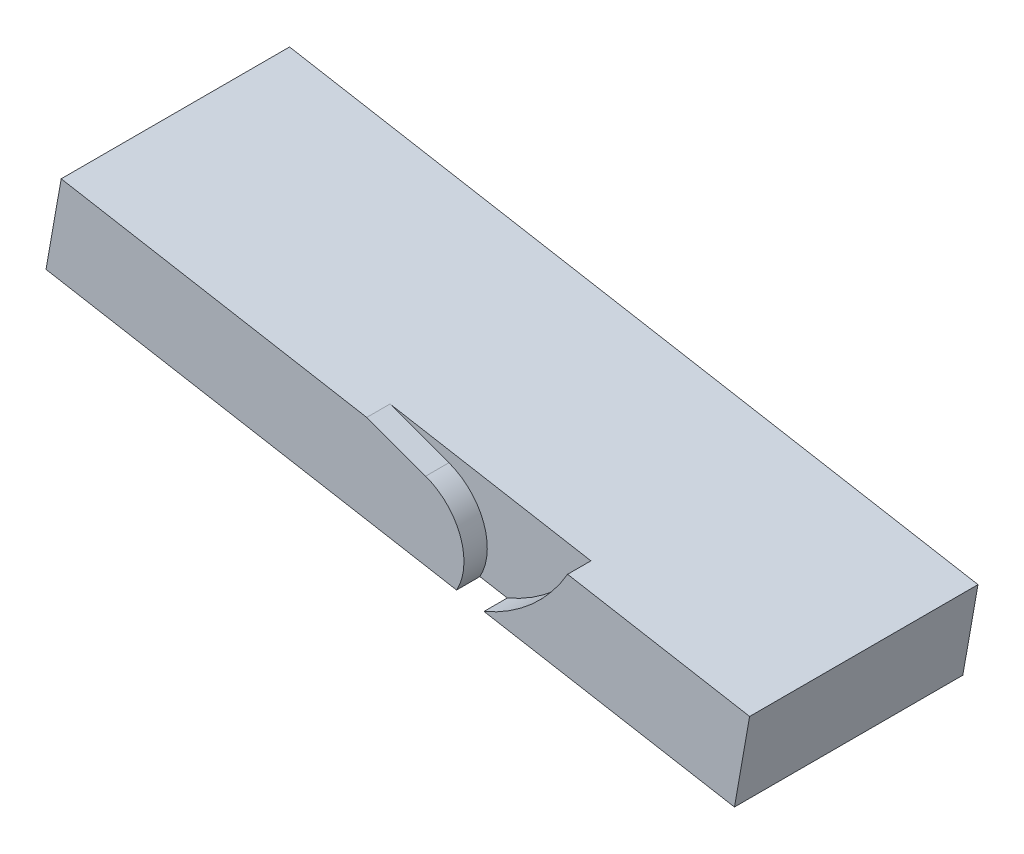
from build123d import *

# Parameters (mm, degrees)
BOSS_EXTRUDE1_DEPTH        = 3.048
BOSS_EXTRUDE2_DEPTH        = 2.032
BOSS_EXTRUDE2_DEPTH_BACK   = 47.752
BOSS_EXTRUDE2_2_DEPTH      = 2.032
BOSS_EXTRUDE2_2_DEPTH_BACK = 47.752


with BuildPart() as part:
    # Sketch1 → Boss-Extrude1 (new, symmetric)
    with BuildSketch(Plane.XY):
        with BuildLine():
            ThreePointArc((0, 27.535484012), (-9.412998127, 39.802742006), (0, 52.07))
            Line((0, 52.07), (-11.040532194, 49.111698314))
            ThreePointArc((-11.040532194, 49.111698314), (-39.066320922, 14.192289272), (-14.190605813, -23.03684931))
            Line((-14.190605813, -23.03684931), (0, -28.201807432))
            ThreePointArc((0, -28.201807432), (8.35634418, -40.135903716), (0, -52.07))
            Line((0, -52.07), (10.740686656, -48.160709762))
            ThreePointArc((10.740686656, -48.160709762), (36.144496882, -10.141220984), (7.52373904, 25.519504212))
            Line((7.52373904, 25.519504212), (0, 27.535484012))
        make_face()
        with BuildLine():
            Line((-12.7, 7.332348419), (-1.374815329, 13.870946837))
            ThreePointArc((-1.374815329, 13.870946837), (-0.410875234, 16.198104087), (1.5875, 14.664696837))
            ThreePointArc((1.5875, 14.664696837), (1.533407249, 14.253821603), (1.374815329, 13.870946837))
            Line((1.374815329, 13.870946837), (12.7, 7.332348419))
            Line((12.7, 7.332348419), (12.7, -7.332348419))
            Line((12.7, -7.332348419), (0, -14.664696837))
            Line((0, -14.664696837), (-12.7, -7.332348419))
            Line((-12.7, -7.332348419), (-12.7, 7.332348419))
        make_face(mode=Mode.SUBTRACT)
    extrude(amount=BOSS_EXTRUDE1_DEPTH, both=True)


with BuildPart() as body_2:
    # Sketch2 → Boss-Extrude2 (new, two sides: drawn at the far end of the back side and taken through both)
    with BuildSketch(Plane.XY.offset(-BOSS_EXTRUDE2_DEPTH_BACK)):
        Polygon((-70.631687067, 38.246108065), (79.453014492, 11.782125788), (82.761012277, 30.542713483), (-67.323689282, 57.00669576), align=None)
    extrude(amount=BOSS_EXTRUDE2_DEPTH + BOSS_EXTRUDE2_DEPTH_BACK)


with BuildPart() as body_3:
    # Sketch2 → Boss-Extrude2 2 (new, two sides: drawn at the far end of the back side and taken through both)
    with BuildSketch(Plane.XY.offset(-BOSS_EXTRUDE2_2_DEPTH_BACK)):
        Polygon((-79.453014492, -11.782125788), (70.631687067, -38.246108065), (67.323689282, -57.00669576), (-82.761012277, -30.542713483), align=None)
    extrude(amount=BOSS_EXTRUDE2_2_DEPTH + BOSS_EXTRUDE2_2_DEPTH_BACK)

    # Intersect1: read off the stored shape, not the designer's step
    # Intersect1: cut body 2, part
    add(body_2.part, mode=Mode.SUBTRACT)
    add(part.part, mode=Mode.SUBTRACT)


solid = body_3.part
